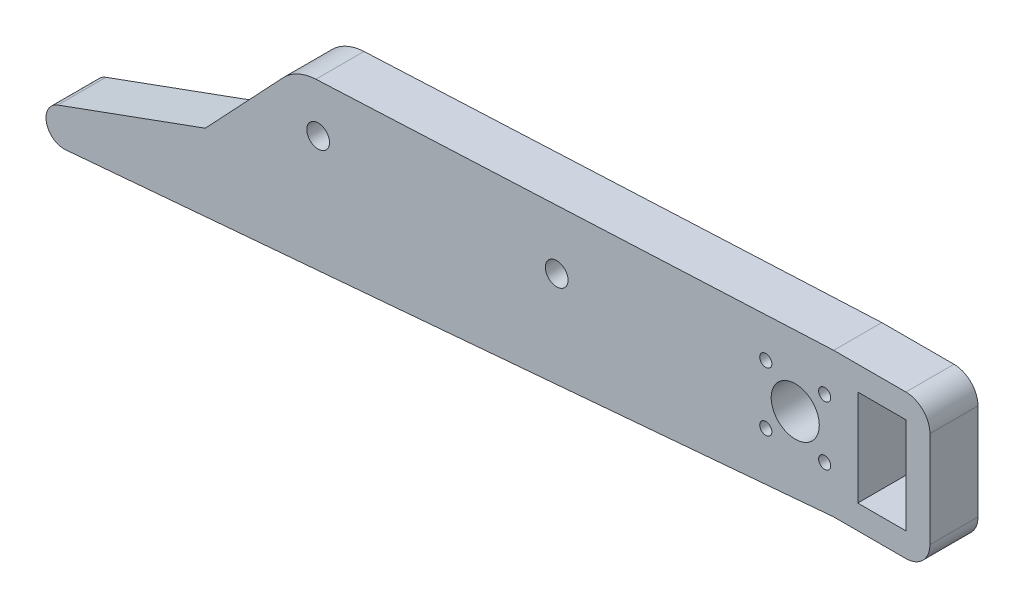
from build123d import *

# Parameters (mm, degrees)
SKETCH1_R           = 1.5
SKETCH1_R_2         = 0.8
SKETCH1_R_3         = 3.175
SKETCH1_W           = 6.35
SKETCH1_H           = 12.7
BOSS_EXTRUDE1_DEPTH = 3.175
FILLET1_R           = 3.175


with BuildPart() as part:
    # Sketch1 → Boss-Extrude1 (new, symmetric)
    with BuildSketch(Plane.XY):
        with BuildLine():
            Line((49.276, 9.525), (36.576, 9.525))
            Line((36.576, 9.525), (-31.791214639, 6.343133951))
            ThreePointArc((-31.791214639, 6.343133951), (-34.148654973, 5.769395254), (-36.118832942, 4.353379789))
            Line((-36.118832942, 4.353379789), (-46.397973184, -6.561989517))
            Line((-46.397973184, -6.561989517), (-65.861496639, -13.646132709))
            ThreePointArc((-65.861496639, -13.646132709), (-67.372222956, -16.397560002), (-64.842812423, -18.25625))
            Line((-64.842812423, -18.25625), (36.576, -9.525))
            Line((36.576, -9.525), (49.276, -9.525))
            Line((49.276, -9.525), (49.276, 9.525))
        make_face()
        with Locations((-31.496, 0)):
            Circle(SKETCH1_R, mode=Mode.SUBTRACT)
        Circle(SKETCH1_R, mode=Mode.SUBTRACT)
        with Locations((27.606912703, -3.889087297)):
            Circle(SKETCH1_R_2, mode=Mode.SUBTRACT)
        with Locations((35.385087297, -3.889087297)):
            Circle(SKETCH1_R_2, mode=Mode.SUBTRACT)
        with Locations((31.496, 0)):
            Circle(SKETCH1_R_3, mode=Mode.SUBTRACT)
        with Locations((42.926, 0)):
            Rectangle(SKETCH1_W, SKETCH1_H, mode=Mode.SUBTRACT)
        with Locations((27.606912703, 3.889087297)):
            Circle(SKETCH1_R_2, mode=Mode.SUBTRACT)
        with Locations((35.385087297, 3.889087297)):
            Circle(SKETCH1_R_2, mode=Mode.SUBTRACT)
    extrude(amount=BOSS_EXTRUDE1_DEPTH, both=True)

    # Fillet1
    fillet1_edges = [part.edges().sort_by_distance(p)[0] for p in [
        (49.276, -9.525, 0),
        (49.276, 9.525, 0),
    ]]
    fillet(fillet1_edges, radius=FILLET1_R)


solid = part.part
